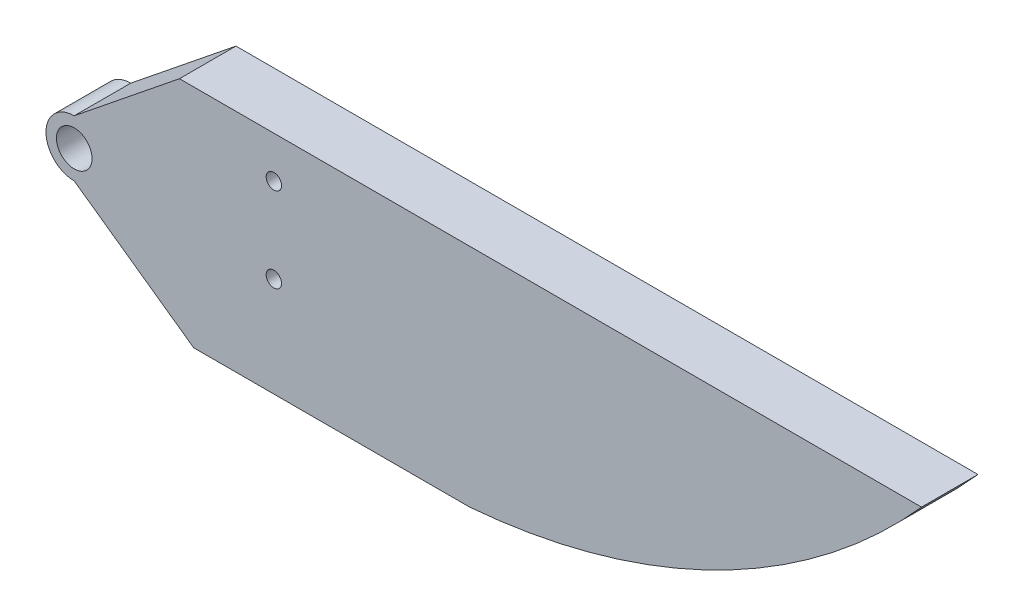
from build123d import *

# Parameters (mm, degrees)
SKETCH1_W                 = 203.2
SKETCH1_H                 = 50.8
BOSS_EXTRUDE1_DEPTH       = 12.7
SKETCH3_R                 = 4
CUT_EXTRUDE1_DEPTH        = 106.494123059
CUT_EXTRUDE2_DEPTH        = 106.494123059
TAP_DRILL_FOR_8_32_TAP1_D = 3.4544
SKETCH10_R                = 1.905
CUT_EXTRUDE3_DEPTH        = 5.08


with BuildPart() as part:
    # Sketch1 → Boss-Extrude1 (new body)
    with BuildSketch(Plane.XY):
        Rectangle(SKETCH1_W, SKETCH1_H)
    extrude(amount=BOSS_EXTRUDE1_DEPTH)

    # Sketch3 → Cut-Extrude1 (cut, through all)
    with BuildSketch(Plane.XY.offset(12.7)):
        with Locations((-88.9, 0)):
            Circle(SKETCH3_R)
    extrude(amount=-CUT_EXTRUDE1_DEPTH, mode=Mode.SUBTRACT)

    # Sketch5 → Cut-Extrude2 (cut, through all)
    with BuildSketch(Plane.XY.offset(12.7)):
        with BuildLine():
            Line((-88.9, -6.35), (-62.046109456, -25.4))
            Line((-62.046109456, -25.4), (-101.6, -25.4))
            Line((-101.6, -25.4), (-101.6, 25.4))
            Line((-101.6, 25.4), (-65.239311186, 25.4))
            Line((-65.239311186, 25.4), (-88.9, 6.35))
            ThreePointArc((-88.9, 6.35), (-95.25, 0), (-88.9, -6.35))
        make_face()
        with BuildLine():
            Line((101.6, 25.4), (101.6, -25.4))
            Line((101.6, -25.4), (0, -25.4))
            ThreePointArc((0, -25.4), (55.709861996, -9.819723993), (101.6, 25.4))
        make_face()
    extrude(amount=-CUT_EXTRUDE2_DEPTH, mode=Mode.SUBTRACT)

    # Tap Drill for #8-32 Tap1 (through all)
    with Locations(Plane(origin=(0, 0, 0), x_dir=(-1, 0, 0), z_dir=(0, 0, -1))):
        with Locations((44.020428639, 16.052306877), (44.020428639, -2.997693123)):
            Hole(TAP_DRILL_FOR_8_32_TAP1_D / 2)

    # Sketch10 → Cut-Extrude3 (cut)
    with BuildSketch(Plane.ZY.offset(95.25)):
        with Locations((6.089367744, 0)):
            Circle(SKETCH10_R)
    extrude(amount=-CUT_EXTRUDE3_DEPTH, mode=Mode.SUBTRACT)


solid = part.part
